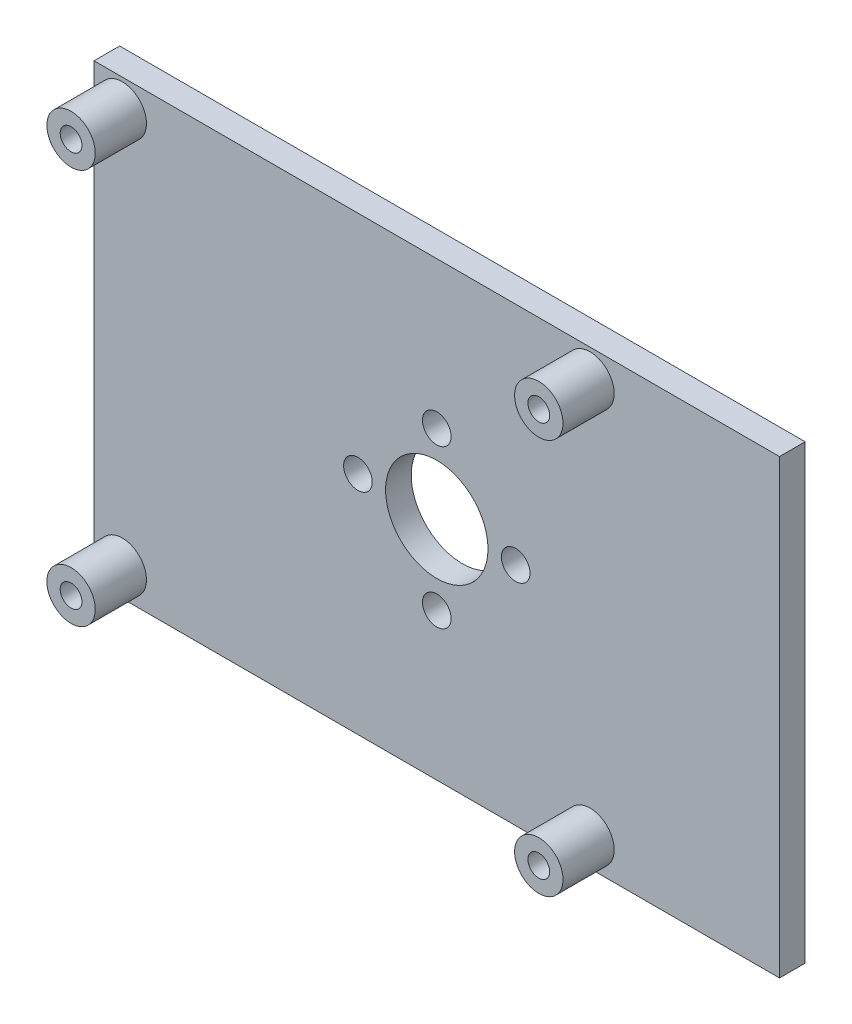
from build123d import *

# Parameters (mm, degrees)
SKETCH1_W           = 85
SKETCH1_H           = 56
BOSS_EXTRUDE1_DEPTH = 3.175
SKETCH2_R           = 6.35
CUT_EXTRUDE1_DEPTH  = 3.175
SKETCH3_R           = 1.778
CUT_EXTRUDE2_DEPTH  = 3.175
CIRPATTERN1_COUNT   = 4
SKETCH4_R           = 3
SKETCH4_R_2         = 1.35
BOSS_EXTRUDE2_DEPTH = 6.35


with BuildPart() as part:
    # Sketch1 → Boss-Extrude1 (new body)
    with BuildSketch(Plane.XY):
        with Locations((42.5, 28)):
            Rectangle(SKETCH1_W, SKETCH1_H)
    extrude(amount=BOSS_EXTRUDE1_DEPTH)

    # Sketch2 → Cut-Extrude1 (cut)
    with BuildSketch(Plane.XY.offset(3.175)):
        with Locations((42.5, 28)):
            Circle(SKETCH2_R)
    extrude(amount=-CUT_EXTRUDE1_DEPTH, mode=Mode.SUBTRACT)

    # Sketch3 → Cut-Extrude2 (cut)
    with BuildSketch(Plane.XY.offset(3.175)):
        with Locations((42.5, 37.779)):
            Circle(SKETCH3_R)
    cut_extrude2 = extrude(amount=-CUT_EXTRUDE2_DEPTH, mode=Mode.SUBTRACT)

    # CirPattern1: Cut-Extrude2 ×4 about axis
    cirpattern1_axis = Axis((42.5, 28, 3.175), (0, 0, 1))
    for i in range(1, CIRPATTERN1_COUNT):
        add(cut_extrude2.rotate(cirpattern1_axis, i * 360 / CIRPATTERN1_COUNT), mode=Mode.SUBTRACT)

    # Sketch4 → Boss-Extrude2 (add)
    # profile 1 of 4: a face of its own
    with BuildSketch(Plane.XY.offset(3.175)):
        with Locations((3.5, 52.5)):
            Circle(SKETCH4_R)
        with Locations((3.5, 52.5)):
            Circle(SKETCH4_R_2, mode=Mode.SUBTRACT)
    # profile 2 of 4: a face of its own
    with BuildSketch(Plane.XY.offset(3.175)):
        with Locations((3.5, 3.5)):
            Circle(SKETCH4_R)
        with Locations((3.5, 3.5)):
            Circle(SKETCH4_R_2, mode=Mode.SUBTRACT)
    # profile 3 of 4: a face of its own
    with BuildSketch(Plane.XY.offset(3.175)):
        with Locations((61.5, 52.5)):
            Circle(SKETCH4_R)
        with Locations((61.5, 52.5)):
            Circle(SKETCH4_R_2, mode=Mode.SUBTRACT)
    # profile 4 of 4: a face of its own
    with BuildSketch(Plane.XY.offset(3.175)):
        with Locations((61.5, 3.5)):
            Circle(SKETCH4_R)
        with Locations((61.5, 3.5)):
            Circle(SKETCH4_R_2, mode=Mode.SUBTRACT)
    extrude(amount=BOSS_EXTRUDE2_DEPTH)


solid = part.part
